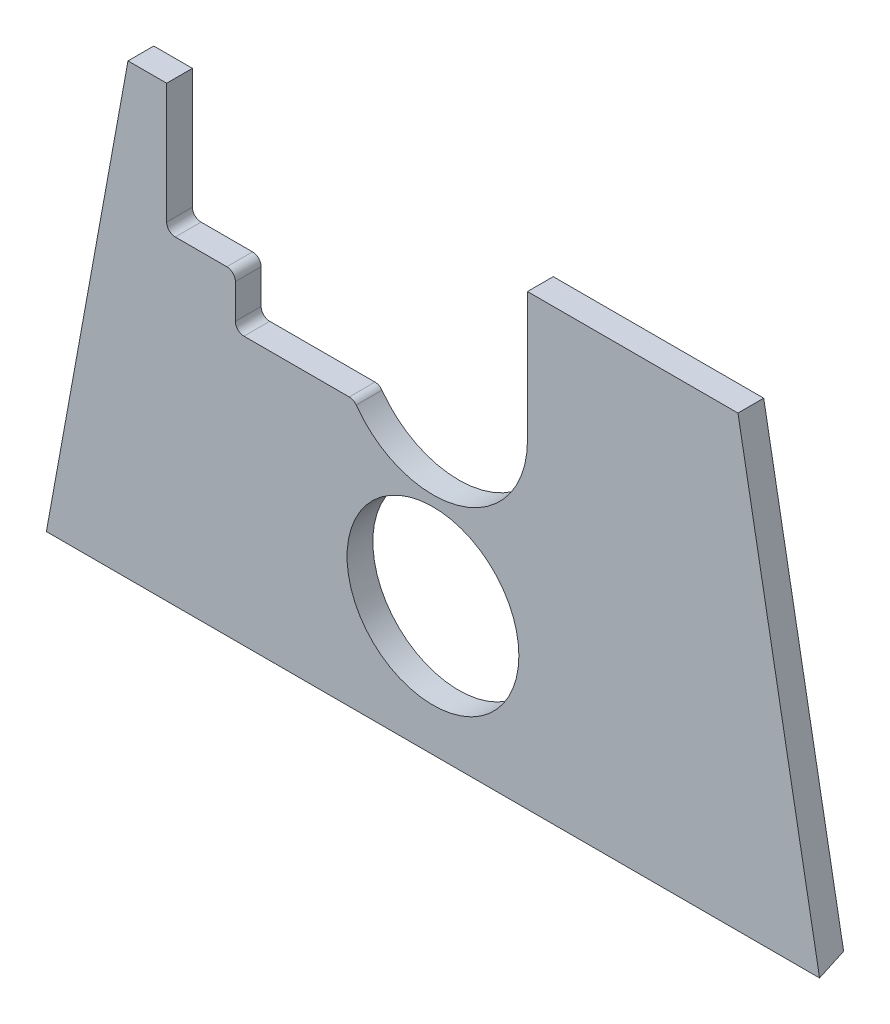
from build123d import *

# Parameters (mm, degrees)
BOSS_EXTRUDE1_DEPTH = 1.5
CHAMFER1_SIZE2      = 1.091910703
CHAMFER1_SIZE       = 3
CUT_EXTRUDE1_DEPTH  = 69.98434605
FILLET1_R           = 1


with BuildPart() as part:
    # Sketch1 → Boss-Extrude1 (new, symmetric)
    with BuildSketch(Plane.XY):
        Polygon((-45, 0), (45, 0), (35.5, 52.2), (-35.5, 52.2), align=None)
    extrude(amount=BOSS_EXTRUDE1_DEPTH, both=True)

    # Chamfer1
    chamfer1_edges = [part.edges().sort_by_distance(p)[0] for p in [
        (0, 0, -1.5),
    ]]
    chamfer1_side = [part.faces().sort_by_distance(p)[0] for p in [
        (0, 0, -1.478161786),
    ]]
    chamfer(chamfer1_edges, length=CHAMFER1_SIZE - 0.0001, length2=CHAMFER1_SIZE2 - 0.0001, reference=chamfer1_side[0])  # a hair under: the kernel refuses the full size

    # Sketch2 → Cut-Extrude1 (cut, through all)
    with BuildSketch(Plane.XY.offset(1.5)):
        Polygon((-11, 37.2), (-11, 52.2), (-31, 52.2), (-31, 37.2), (-23, 37.2), align=None)
        with BuildLine():
            ThreePointArc((-9.219544457, 31.2), (-5.244044241, 27.530460197), (0, 26.2))
            Line((0, 26.2), (0, 52.2))
            Line((0, 52.2), (-11, 52.2))
            Line((-11, 52.2), (-11, 37.2))
            ThreePointArc((-11, 37.2), (-10.545496409, 34.070702078), (-9.219544457, 31.2))
        make_face()
        with BuildLine():
            Line((0, 52.2), (0, 26.2))
            ThreePointArc((0, 26.2), (7.778174593, 29.421825407), (11, 37.2))
            Line((11, 37.2), (11, 52.2))
            Line((11, 52.2), (0, 52.2))
        make_face()
        with BuildLine():
            ThreePointArc((0, 25), (-10, 15), (0, 5))
            Line((0, 5), (0, 25))
        make_face()
        with BuildLine():
            Line((0, 25), (0, 5))
            ThreePointArc((0, 5), (7.071067812, 7.928932188), (10, 15))
            ThreePointArc((10, 15), (7.071067812, 22.071067812), (0, 25))
        make_face()
        with BuildLine():
            Line((-23, 31.2), (-9.219544457, 31.2))
            ThreePointArc((-9.219544457, 31.2), (-10.545496409, 34.070702078), (-11, 37.2))
            Line((-11, 37.2), (-23, 37.2))
            Line((-23, 37.2), (-23, 31.2))
        make_face()
    extrude(amount=-CUT_EXTRUDE1_DEPTH, mode=Mode.SUBTRACT)

    # Fillet1
    fillet1_edges = [part.edges().sort_by_distance(p)[0] for p in [
        (-9.219544457, 31.2, 0),
        (-23, 31.2, 0),
        (-23, 37.2, 0),
        (-31, 37.2, 0),
    ]]
    fillet(fillet1_edges, radius=FILLET1_R)


solid = part.part
